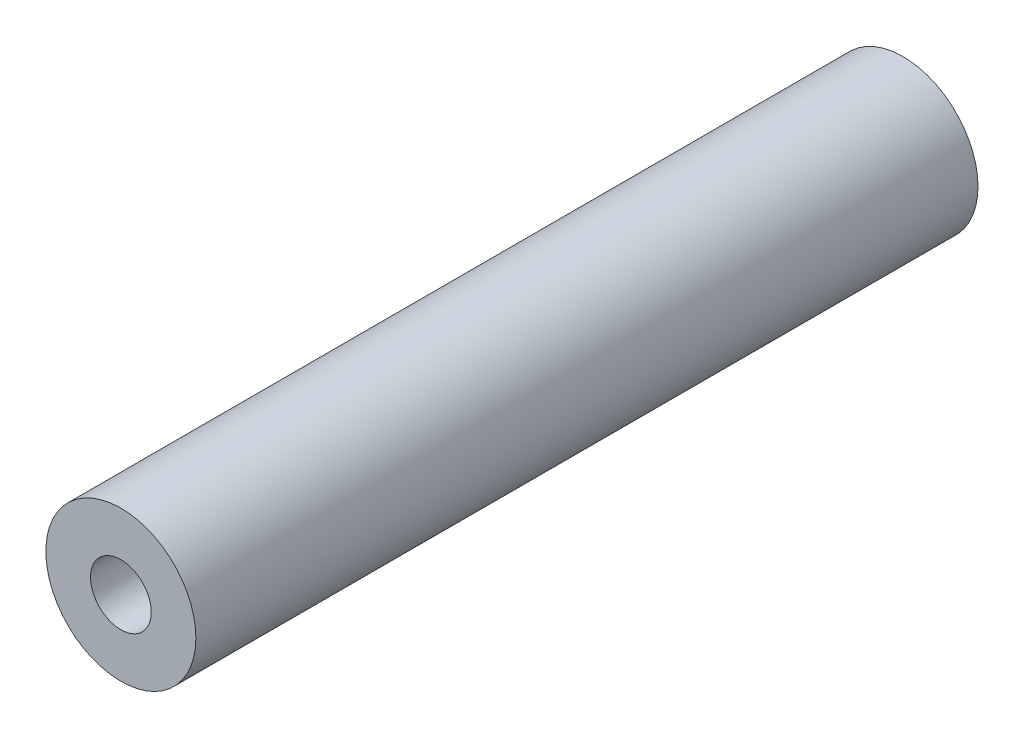
from build123d import *

# Parameters (mm, degrees)
SKETCH1_R                      = 6.4
BOSS_EXTRUDE1_DEPTH            = 66.73
F_6_0_204_DIAMETER_HOLE1_D     = 5.1816
F_6_0_204_DIAMETER_HOLE1_DEPTH = 30
F_6_0_204_DIAMETER_HOLE1_TIP   = 1.556709692
F_6_0_204_DIAMETER_HOLE2_D     = 5.1816
F_6_0_204_DIAMETER_HOLE2_DEPTH = 30
F_6_0_204_DIAMETER_HOLE2_TIP   = 1.556709692


with BuildPart() as part:
    # Sketch1 → Boss-Extrude1 (new body)
    with BuildSketch(Plane.XY):
        Circle(SKETCH1_R)
    extrude(amount=BOSS_EXTRUDE1_DEPTH)

    # #6 (0.204) Diameter Hole1
    with Locations(Plane(origin=(0, 0, 0), x_dir=(-1, 0, 0), z_dir=(0, 0, -1))):
        with Locations((0, 0)):
            Hole(F_6_0_204_DIAMETER_HOLE1_D / 2, depth=F_6_0_204_DIAMETER_HOLE1_DEPTH)
            with Locations((0, 0, -(F_6_0_204_DIAMETER_HOLE1_DEPTH + F_6_0_204_DIAMETER_HOLE1_TIP / 2))):  # 118° drill point
                Cone(0, F_6_0_204_DIAMETER_HOLE1_D / 2, F_6_0_204_DIAMETER_HOLE1_TIP, mode=Mode.SUBTRACT)

    # #6 (0.204) Diameter Hole2
    with Locations(Plane.XY.offset(66.73)):
        with Locations((0, 0)):
            Hole(F_6_0_204_DIAMETER_HOLE2_D / 2, depth=F_6_0_204_DIAMETER_HOLE2_DEPTH)
            with Locations((0, 0, -(F_6_0_204_DIAMETER_HOLE2_DEPTH + F_6_0_204_DIAMETER_HOLE2_TIP / 2))):  # 118° drill point
                Cone(0, F_6_0_204_DIAMETER_HOLE2_D / 2, F_6_0_204_DIAMETER_HOLE2_TIP, mode=Mode.SUBTRACT)


solid = part.part
